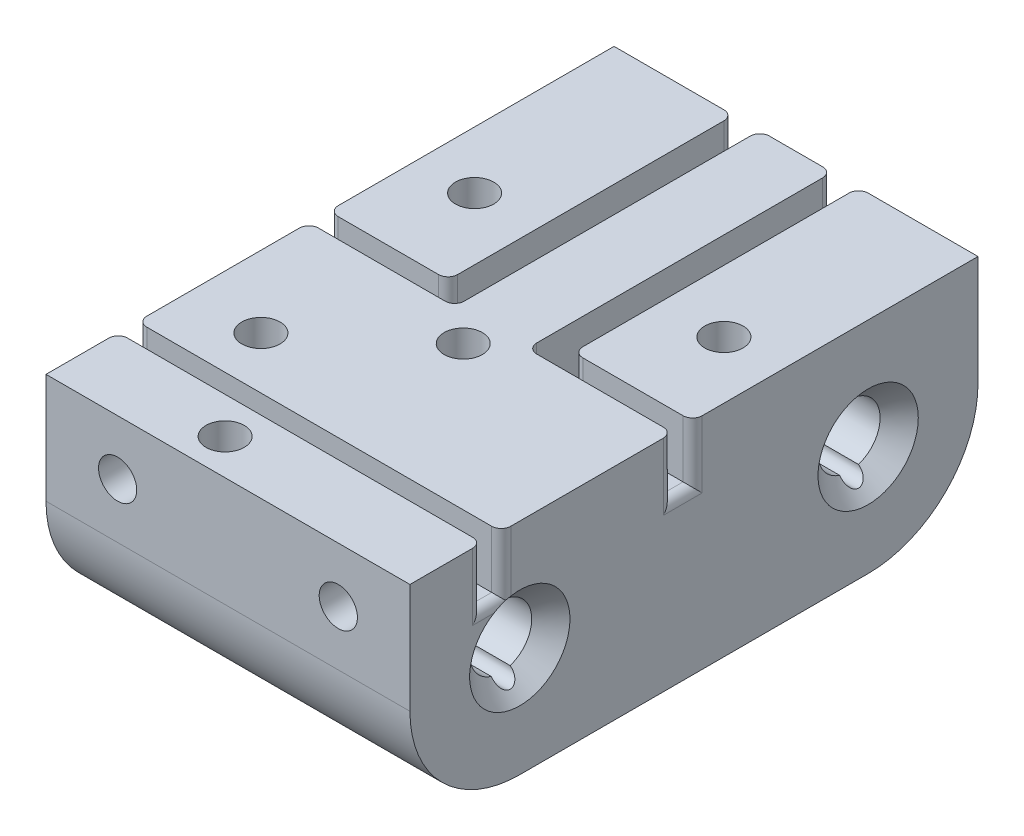
from build123d import *

# Parameters (mm, degrees)
BOSS_EXTRUDE1_DEPTH = 38.1
BOSS_EXTRUDE2_REACH = 55.524
SKETCH2_W           = 38.1
SKETCH2_H           = 36.47
SKETCH3_W           = 38.1
SKETCH3_H           = 2
CUT_EXTRUDE1_DEPTH  = 6
SKETCH4_R           = 1.9999999999999987
SKETCH4_R_2         = 2.0000000000000107
SKETCH4_R_3         = 2.000000000000003
CUT_EXTRUDE2_DEPTH  = 5
CHAMFER1_SIZE       = 2
SKETCH5_R           = 1.0000000000000016
CUT_EXTRUDE3_DEPTH  = 50.679273595736085
SKETCH6_R           = 1.9999999999999996
SKETCH6_R_2         = 2.0000000000000004
CUT_EXTRUDE4_DEPTH  = 5
FILLET1_R           = 1


with BuildPart() as part:
    # Sketch1 → Boss-Extrude1 (new body)
    with BuildSketch(Plane(origin=(0, 0, 0), x_dir=(0, 0, -1), z_dir=(1, 0, 0))):
        with BuildLine():
            ThreePointArc((18.23499999582485, 11.500000000000005), (10.103272014878568, 8.131727982169165), (6.735000000000001, 7.91e-15))
            Line((6.734999999999999, 4.45e-15), (14.985, 5.93e-15))
            ThreePointArc((14.985000000000001, 6.9e-15), (18.235, 3.2500000000000053), (21.485, 6.51e-15))
            Line((21.485000000000003, 8.96e-15), (29.73499999999999, 1.041e-14))
            ThreePointArc((29.735, 6.51e-15), (26.366727982169156, 8.131727985121442), (18.234999995824847, 11.500000000000005))
        make_face()
        with BuildLine():
            Line((14.985, 5.93e-15), (6.734999999999999, 4.45e-15))
            ThreePointArc((6.735000000000001, 7.91e-15), (18.234999999999996, -11.499999999999991), (29.735, 3.69e-15))
            Line((29.73499999999999, 1.041e-14), (21.485000000000003, 8.96e-15))
            ThreePointArc((21.485, 5.71e-15), (18.235, -3.249999999999992), (14.985000000000001, 6.9e-15))
        make_face()
        with BuildLine():
            ThreePointArc((-21.485, 4e-16), (-18.235, 3.2500000000000004), (-14.985, 0))
            Line((-14.985, 5.8e-16), (-6.734999999999999, 2.05e-15))
            ThreePointArc((-6.734999999999999, 0), (-10.103272016354705, 8.131727983645298), (-18.235000000000003, 11.5))
            ThreePointArc((-18.235000000000003, 11.5), (-26.366727983645298, 8.131727983645296), (-29.735, 1.41e-15))
            Line((-29.734999999999996, 0), (-21.485, 1.44e-15))
        make_face()
        with BuildLine():
            Line((-6.734999999999999, 2.05e-15), (-14.985, 5.8e-16))
            ThreePointArc((-14.985, -8e-16), (-18.235, -3.2500000000000004), (-21.485, 4e-16))
            Line((-21.485, 1.44e-15), (-29.734999999999996, 0))
            ThreePointArc((-29.735, 1.41e-15), (-18.235000000000003, -11.5), (-6.734999999999999, -2.82e-15))
        make_face()
        with BuildLine():
            ThreePointArc((-18.235000000000003, 11.5), (-10.103272016354705, 8.131727983645298), (-6.734999999999999, 0))
            Line((-6.734999999999999, 2.05e-15), (6.734999999999999, 4.45e-15))
            ThreePointArc((6.735000000000001, 7.91e-15), (10.103272014878568, 8.131727982169165), (18.23499999582485, 11.500000000000005))
            Line((18.23499999582485, 11.500000000000009), (-18.235000000000003, 11.500000000000002))
        make_face()
        with BuildLine():
            Line((29.734999999999992, 11.50000000000001), (18.23499999582485, 11.500000000000009))
            ThreePointArc((18.234999995824847, 11.500000000000005), (26.366727982169156, 8.131727985121442), (29.735, 6.51e-15))
            Line((29.734999999999992, 1.066e-14), (29.734999999999992, 11.50000000000001))
        make_face()
        with BuildLine():
            Line((-29.735, 11.5), (-29.734999999999996, 0))
            ThreePointArc((-29.735, 1.41e-15), (-26.366727983645298, 8.131727983645296), (-18.235000000000003, 11.5))
            Line((-18.235000000000003, 11.500000000000002), (-29.735, 11.5))
        make_face()
    extrude(amount=BOSS_EXTRUDE1_DEPTH)

    # Sketch2 → Boss-Extrude2 (add, up to next)
    with BuildSketch(Plane(origin=(0, -11.499999999999995, -2.74e-15), x_dir=(-1, 0, 0), z_dir=(0, -1, -2.4e-16)), mode=Mode.PRIVATE) as boss_extrude2_sk1:
        with Locations((-19.05, -1.78e-15)):
            Rectangle(SKETCH2_W, SKETCH2_H)
    boss_extrude2_tool1 = extrude(boss_extrude2_sk1.sketch, amount=-BOSS_EXTRUDE2_REACH, mode=Mode.PRIVATE) - part.part
    add(boss_extrude2_tool1.solids().sort_by_distance((19.05, -11.5, 0))[0])

    # Sketch3 → Cut-Extrude1 (cut)
    with BuildSketch(Plane(origin=(0, 11.500000000000005, 2.01e-15), x_dir=(1, 0, 0), z_dir=(0, 1, 1.8e-16))):
        Polygon((25.600000000007118, 29.734999999999996), (22.840000000007127, 29.734999999999996), (22.84000000000712, -2.210000000000001), (38.10000000000001, -2.2100000000000035), (38.1, -0.13999999999999702), (25.600000000007118, -0.13999999999999777), align=None)
        Polygon((12.499999999992893, -0.13999999999999777), (3.69e-15, -0.13999999999999777), (3.93e-15, -2.2100000000000044), (15.259999999992889, -2.2100000000000017), (15.259999999992884, 29.734999999999996), (12.499999999992893, 29.734999999999996), align=None)
        with Locations((19.05, -21.177500000000002)):
            Rectangle(SKETCH3_W, SKETCH3_H)
    extrude(amount=-CUT_EXTRUDE1_DEPTH, mode=Mode.SUBTRACT)

    # Sketch4 → Cut-Extrude2 (cut)
    with BuildSketch(Plane(origin=(0, 11.500000000000005, 2.01e-15), x_dir=(1, 0, 0), z_dir=(0, 1, 1.8e-16))):
        with Locations(Location((6.000000000000003, 9.13499999999998, 0), (0, 0, 270))):
            Circle(SKETCH4_R)
        with Locations(Location((32.1, 9.134999999999984, 0), (0, 0, 270))):
            Circle(SKETCH4_R_2)
        with BuildLine():
            ThreePointArc((9.500000000000005, -14.734999999999998), (7.5000000000000036, -12.734999999999996), (5.500000000000002, -14.734999999999998))
            Line((5.500000000000002, -14.734999999999998), (9.500000000000005, -14.734999999999998))
        make_face()
        with BuildLine():
            Line((9.500000000000005, -14.734999999999998), (5.500000000000002, -14.734999999999998))
            ThreePointArc((5.500000000000002, -14.734999999999998), (7.5000000000000036, -16.735), (9.500000000000005, -14.734999999999998))
        make_face()
        with BuildLine():
            ThreePointArc((15.000000000000032, -23.98499999999999), (12.999999999999993, -25.985), (15.000000000000034, -27.98500000000001))
            Line((15.000000000000004, -27.98500000000001), (15.000000000000004, -23.98499999999999))
        make_face()
        with BuildLine():
            Line((15.000000000000004, -23.98499999999999), (15.000000000000004, -27.98500000000001))
            ThreePointArc((15.000000000000034, -27.98500000000001), (16.414213562373117, -27.39921356237309), (17.000000000000014, -25.985))
            ThreePointArc((17.000000000000014, -25.985), (16.414213562373117, -24.570786437626907), (15.000000000000032, -23.98499999999999))
        make_face()
        with Locations(Location((19.05, -5.105000000000003, 0), (0, 0, 270))):
            Circle(SKETCH4_R_3)
    extrude(amount=-CUT_EXTRUDE2_DEPTH, mode=Mode.SUBTRACT)

    # Chamfer1
    chamfer1_edges = [part.edges().sort_by_distance(p)[0] for p in [
        (0, -1.93e-15, 21.485),
        (0, 3.13e-15, -14.985),
        (38.1, 9.21e-15, -14.985),
        (38.1, 1.4e-15, 21.485),
    ]]
    chamfer(chamfer1_edges, length=CHAMFER1_SIZE)

    # Sketch5 → Cut-Extrude3 (cut, through all)
    with BuildSketch(Plane.ZY):
        with Locations((-18.235, -3.249999999999993)):
            Circle(SKETCH5_R)
        with Locations((18.235, -3.2499999999999996)):
            Circle(SKETCH5_R)
    extrude(amount=-CUT_EXTRUDE3_DEPTH, mode=Mode.SUBTRACT)

    # Sketch6 → Cut-Extrude4 (cut)
    with BuildSketch(Plane.XY.offset(29.734999999999996)):
        with Locations((7.500000000000001, 5.750000000000005)):
            Circle(SKETCH6_R)
        with Locations((30.599999999999987, 5.750000000000005)):
            Circle(SKETCH6_R_2)
    extrude(amount=-CUT_EXTRUDE4_DEPTH, mode=Mode.SUBTRACT)

    # Fillet1
    # the kernel refuses this fillet: 1 mm, written as the material it adds along each edge
    with BuildSketch(Plane(origin=(15.259999999992889, 11.500000000000005, 2.2100000000000035), x_dir=(-1, 0, 4.4e-16), z_dir=(0, -1, -1.8e-16))) as fillet1_piece_1:
        with BuildLine():
            CenterArc((FILLET1_R, FILLET1_R), FILLET1_R, 180, 90)
            Line((-4.4e-16, FILLET1_R), (-FILLET1_R * 0.02, FILLET1_R))
            Line((-FILLET1_R * 0.02, FILLET1_R), (-FILLET1_R * 0.02, -FILLET1_R * 0.02))
            Line((-FILLET1_R * 0.02, -FILLET1_R * 0.02), (FILLET1_R, -FILLET1_R * 0.02))
            Line((FILLET1_R, -FILLET1_R * 0.02), (FILLET1_R, 0))
        make_face()
    extrude(amount=6)
    with BuildSketch(Plane(origin=(22.84000000000712, 11.500000000000005, 2.2100000000000035), x_dir=(0, 1.8e-16, -1), z_dir=(0, -1, -1.8e-16))) as fillet1_piece_2:
        with BuildLine():
            CenterArc((FILLET1_R, FILLET1_R), FILLET1_R, 180, 90)
            Line((-8.9e-16, FILLET1_R), (-FILLET1_R * 0.02, FILLET1_R))
            Line((-FILLET1_R * 0.02, FILLET1_R), (-FILLET1_R * 0.02, -FILLET1_R * 0.02))
            Line((-FILLET1_R * 0.02, -FILLET1_R * 0.02), (FILLET1_R, -FILLET1_R * 0.02))
            Line((FILLET1_R, -FILLET1_R * 0.02), (FILLET1_R, 0))
        make_face()
    extrude(amount=6)
    # the kernel refuses this fillet: 1 mm, written as the material it takes off along each edge
    with BuildSketch(Plane(origin=(0, 5.500000000000002, 22.177500000000002), x_dir=(0, -1, -1.8e-16), z_dir=(0, 1.8e-16, -1))) as fillet1_2_piece_1:
        with BuildLine():
            CenterArc((FILLET1_R, -FILLET1_R), FILLET1_R, 90, 90)
            Line((1.78e-15, -FILLET1_R), (-FILLET1_R * 0.02, -FILLET1_R))
            Line((-FILLET1_R * 0.02, -FILLET1_R), (-FILLET1_R * 0.02, FILLET1_R * 0.02))
            Line((-FILLET1_R * 0.02, FILLET1_R * 0.02), (FILLET1_R, FILLET1_R * 0.02))
            Line((FILLET1_R, FILLET1_R * 0.02), (FILLET1_R, 0))
        make_face()
    extrude(amount=2, mode=Mode.SUBTRACT)
    with BuildSketch(Plane(origin=(0, 11.500000000000002, 22.177500000000006), x_dir=(0, -1.8e-16, 1), z_dir=(0, -1, -1.8e-16))) as fillet1_2_piece_2:
        with BuildLine():
            CenterArc((FILLET1_R, -FILLET1_R), FILLET1_R, 90, 90)
            Line((-3.55e-15, -FILLET1_R), (-FILLET1_R * 0.02, -FILLET1_R))
            Line((-FILLET1_R * 0.02, -FILLET1_R), (-FILLET1_R * 0.02, FILLET1_R * 0.02))
            Line((-FILLET1_R * 0.02, FILLET1_R * 0.02), (FILLET1_R, FILLET1_R * 0.02))
            Line((FILLET1_R, FILLET1_R * 0.02), (FILLET1_R, 0))
        make_face()
    extrude(amount=6, mode=Mode.SUBTRACT)
    with BuildSketch(Plane(origin=(0, 11.500000000000002, 20.177500000000006), x_dir=(0, 1.8e-16, -1), z_dir=(0, -1, -1.8e-16))) as fillet1_2_piece_3:
        with BuildLine():
            CenterArc((FILLET1_R, FILLET1_R), FILLET1_R, 180, 90)
            Line((3.55e-15, FILLET1_R), (-FILLET1_R * 0.02, FILLET1_R))
            Line((-FILLET1_R * 0.02, FILLET1_R), (-FILLET1_R * 0.02, -FILLET1_R * 0.02))
            Line((-FILLET1_R * 0.02, -FILLET1_R * 0.02), (FILLET1_R, -FILLET1_R * 0.02))
            Line((FILLET1_R, -FILLET1_R * 0.02), (FILLET1_R, 0))
        make_face()
    extrude(amount=6, mode=Mode.SUBTRACT)
    with BuildSketch(Plane(origin=(38.1, 11.500000000000002, 20.177500000000006), x_dir=(-1, 0, 0), z_dir=(0, -1, -1.8e-16))) as fillet1_2_piece_4:
        with BuildLine():
            CenterArc((FILLET1_R, FILLET1_R), FILLET1_R, 180, 90)
            Line((0, FILLET1_R), (-FILLET1_R * 0.02, FILLET1_R))
            Line((-FILLET1_R * 0.02, FILLET1_R), (-FILLET1_R * 0.02, -FILLET1_R * 0.02))
            Line((-FILLET1_R * 0.02, -FILLET1_R * 0.02), (FILLET1_R, -FILLET1_R * 0.02))
            Line((FILLET1_R, -FILLET1_R * 0.02), (FILLET1_R, 0))
        make_face()
    extrude(amount=6, mode=Mode.SUBTRACT)
    with BuildSketch(Plane(origin=(38.1, 11.500000000000002, 22.177500000000006), x_dir=(-1, 0, 0), z_dir=(0, -1, -1.8e-16))) as fillet1_2_piece_5:
        with BuildLine():
            CenterArc((FILLET1_R, -FILLET1_R), FILLET1_R, 90, 89.9999999999998)
            Line((0, -FILLET1_R), (-FILLET1_R * 0.02, -FILLET1_R))
            Line((-FILLET1_R * 0.02, -FILLET1_R), (-FILLET1_R * 0.02, FILLET1_R * 0.02))
            Line((-FILLET1_R * 0.02, FILLET1_R * 0.02), (FILLET1_R, FILLET1_R * 0.02))
            Line((FILLET1_R, FILLET1_R * 0.02), (FILLET1_R, 0))
        make_face()
    extrude(amount=6, mode=Mode.SUBTRACT)
    with BuildSketch(Plane(origin=(38.1, 5.500000000000002, 20.177500000000002), x_dir=(-1, 0, 0), z_dir=(0, -1.8e-16, 1))) as fillet1_2_piece_6:
        with BuildLine():
            CenterArc((FILLET1_R, FILLET1_R), FILLET1_R, 180, 90)
            Line((0, FILLET1_R), (-FILLET1_R * 0.02, FILLET1_R))
            Line((-FILLET1_R * 0.02, FILLET1_R), (-FILLET1_R * 0.02, -FILLET1_R * 0.02))
            Line((-FILLET1_R * 0.02, -FILLET1_R * 0.02), (FILLET1_R, -FILLET1_R * 0.02))
            Line((FILLET1_R, -FILLET1_R * 0.02), (FILLET1_R, 0))
        make_face()
    extrude(amount=2, mode=Mode.SUBTRACT)
    with BuildSketch(Plane(origin=(3.68e-15, 5.500000000000005, 0.139999999999998), x_dir=(-3.68e-15, -1, -1.8e-16), z_dir=(1.2e-16, -1.8e-16, 1))) as fillet1_2_piece_7:
        with BuildLine():
            CenterArc((FILLET1_R, FILLET1_R), FILLET1_R, 180, 90.00000000000023)
            Line((-3.68e-15, FILLET1_R), (-FILLET1_R * 0.02, FILLET1_R))
            Line((-FILLET1_R * 0.02, FILLET1_R), (-FILLET1_R * 0.02, -FILLET1_R * 0.02))
            Line((-FILLET1_R * 0.02, -FILLET1_R * 0.02), (FILLET1_R, -FILLET1_R * 0.02))
            Line((FILLET1_R, -FILLET1_R * 0.02), (FILLET1_R, 0))
        make_face()
    extrude(amount=2.0700000000000074, mode=Mode.SUBTRACT)
    with BuildSketch(Plane(origin=(3.74e-15, 11.500000000000005, 2.210000000000006), x_dir=(-3.74e-15, -1.8e-16, 1), z_dir=(0, -1, -1.8e-16))) as fillet1_2_piece_8:
        with BuildLine():
            CenterArc((FILLET1_R, -FILLET1_R), FILLET1_R, 89.99999999999979, 90.00000000000021)
            Line((-1.97e-15, -FILLET1_R), (-FILLET1_R * 0.02, -FILLET1_R))
            Line((-FILLET1_R * 0.02, -FILLET1_R), (-FILLET1_R * 0.02, FILLET1_R * 0.02))
            Line((-FILLET1_R * 0.02, FILLET1_R * 0.02), (FILLET1_R, FILLET1_R * 0.02))
            Line((FILLET1_R, FILLET1_R * 0.02), (FILLET1_R, 0))
        make_face()
    extrude(amount=6, mode=Mode.SUBTRACT)
    with BuildSketch(Plane(origin=(3.68e-15, 11.500000000000005, 0.13999999999999943), x_dir=(-3.68e-15, 1.8e-16, -1), z_dir=(0, -1, -1.8e-16))) as fillet1_2_piece_9:
        with BuildLine():
            CenterArc((FILLET1_R, FILLET1_R), FILLET1_R, 180, 90.00000000000023)
            Line((-4.82e-15, FILLET1_R), (-FILLET1_R * 0.02, FILLET1_R))
            Line((-FILLET1_R * 0.02, FILLET1_R), (-FILLET1_R * 0.02, -FILLET1_R * 0.02))
            Line((-FILLET1_R * 0.02, -FILLET1_R * 0.02), (FILLET1_R, -FILLET1_R * 0.02))
            Line((FILLET1_R, -FILLET1_R * 0.02), (FILLET1_R, 0))
        make_face()
    extrude(amount=6, mode=Mode.SUBTRACT)
    with BuildSketch(Plane(origin=(12.499999999992893, 11.500000000000005, 0.1399999999999998), x_dir=(-1, 0, 0), z_dir=(0, -1, -1.8e-16))) as fillet1_2_piece_10:
        with BuildLine():
            CenterArc((FILLET1_R, FILLET1_R), FILLET1_R, 180.00000000000003, 90)
            Line((0, FILLET1_R), (-FILLET1_R * 0.02, FILLET1_R))
            Line((-FILLET1_R * 0.02, FILLET1_R), (-FILLET1_R * 0.02, -FILLET1_R * 0.02))
            Line((-FILLET1_R * 0.02, -FILLET1_R * 0.02), (FILLET1_R, -FILLET1_R * 0.02))
            Line((FILLET1_R, -FILLET1_R * 0.02), (FILLET1_R, 0))
        make_face()
    extrude(amount=6, mode=Mode.SUBTRACT)
    with BuildSketch(Plane(origin=(15.259999999992884, 5.500000000000011, -29.734999999999996), x_dir=(0, 0, 1), z_dir=(-1, 0, 0))) as fillet1_2_piece_11:
        with BuildLine():
            CenterArc((FILLET1_R, -FILLET1_R), FILLET1_R, 90, 90)
            Line((3.55e-15, -FILLET1_R), (-FILLET1_R * 0.02, -FILLET1_R))
            Line((-FILLET1_R * 0.02, -FILLET1_R), (-FILLET1_R * 0.02, FILLET1_R * 0.02))
            Line((-FILLET1_R * 0.02, FILLET1_R * 0.02), (FILLET1_R, FILLET1_R * 0.02))
            Line((FILLET1_R, FILLET1_R * 0.02), (FILLET1_R, 0))
        make_face()
    extrude(amount=2.759999999999991, mode=Mode.SUBTRACT)
    with BuildSketch(Plane(origin=(12.499999999992893, 11.50000000000001, -29.734999999999992), x_dir=(-1, 0, 0), z_dir=(0, -1, -1.8e-16))) as fillet1_2_piece_12:
        with BuildLine():
            CenterArc((FILLET1_R, -FILLET1_R), FILLET1_R, 90, 90)
            Line((0, -FILLET1_R), (-FILLET1_R * 0.02, -FILLET1_R))
            Line((-FILLET1_R * 0.02, -FILLET1_R), (-FILLET1_R * 0.02, FILLET1_R * 0.02))
            Line((-FILLET1_R * 0.02, FILLET1_R * 0.02), (FILLET1_R, FILLET1_R * 0.02))
            Line((FILLET1_R, FILLET1_R * 0.02), (FILLET1_R, 0))
        make_face()
    extrude(amount=6, mode=Mode.SUBTRACT)
    with BuildSketch(Plane(origin=(15.259999999992884, 11.50000000000001, -29.734999999999992), x_dir=(1, 0, 0), z_dir=(0, -1, -1.8e-16))) as fillet1_2_piece_13:
        with BuildLine():
            CenterArc((FILLET1_R, FILLET1_R), FILLET1_R, 180, 90)
            Line((1.78e-15, FILLET1_R), (-FILLET1_R * 0.02, FILLET1_R))
            Line((-FILLET1_R * 0.02, FILLET1_R), (-FILLET1_R * 0.02, -FILLET1_R * 0.02))
            Line((-FILLET1_R * 0.02, -FILLET1_R * 0.02), (FILLET1_R, -FILLET1_R * 0.02))
            Line((FILLET1_R, -FILLET1_R * 0.02), (FILLET1_R, 0))
        make_face()
    extrude(amount=6, mode=Mode.SUBTRACT)
    with BuildSketch(Plane(origin=(38.1, 5.500000000000005, 2.2100000000000053), x_dir=(0, -1, -1.8e-16), z_dir=(0, 1.8e-16, -1))) as fillet1_2_piece_14:
        with BuildLine():
            CenterArc((FILLET1_R, FILLET1_R), FILLET1_R, 180, 90)
            Line((0, FILLET1_R), (-FILLET1_R * 0.02, FILLET1_R))
            Line((-FILLET1_R * 0.02, FILLET1_R), (-FILLET1_R * 0.02, -FILLET1_R * 0.02))
            Line((-FILLET1_R * 0.02, -FILLET1_R * 0.02), (FILLET1_R, -FILLET1_R * 0.02))
            Line((FILLET1_R, -FILLET1_R * 0.02), (FILLET1_R, 0))
        make_face()
    extrude(amount=2.0700000000000074, mode=Mode.SUBTRACT)
    with BuildSketch(Plane(origin=(38.10000000000001, 11.500000000000005, 0.13999999999999943), x_dir=(-7.11e-15, 1.8e-16, -1), z_dir=(0, -1, -1.8e-16))) as fillet1_2_piece_15:
        with BuildLine():
            CenterArc((FILLET1_R, -FILLET1_R), FILLET1_R, 90.00000000000041, 89.99999999999959)
            Line((5.97e-15, -FILLET1_R), (-FILLET1_R * 0.02, -FILLET1_R))
            Line((-FILLET1_R * 0.02, -FILLET1_R), (-FILLET1_R * 0.02, FILLET1_R * 0.02))
            Line((-FILLET1_R * 0.02, FILLET1_R * 0.02), (FILLET1_R, FILLET1_R * 0.02))
            Line((FILLET1_R, FILLET1_R * 0.02), (FILLET1_R, 0))
        make_face()
    extrude(amount=6, mode=Mode.SUBTRACT)
    with BuildSketch(Plane(origin=(38.10000000000001, 11.500000000000005, 2.210000000000006), x_dir=(-7.11e-15, -1.8e-16, 1), z_dir=(0, -1, -1.8e-16))) as fillet1_2_piece_16:
        with BuildLine():
            CenterArc((FILLET1_R, FILLET1_R), FILLET1_R, 180, 89.9999999999996)
            Line((7.11e-15, FILLET1_R), (-FILLET1_R * 0.02, FILLET1_R))
            Line((-FILLET1_R * 0.02, FILLET1_R), (-FILLET1_R * 0.02, -FILLET1_R * 0.02))
            Line((-FILLET1_R * 0.02, -FILLET1_R * 0.02), (FILLET1_R, -FILLET1_R * 0.02))
            Line((FILLET1_R, -FILLET1_R * 0.02), (FILLET1_R, 0))
        make_face()
    extrude(amount=6, mode=Mode.SUBTRACT)
    with BuildSketch(Plane(origin=(25.600000000007118, 5.500000000000011, -29.734999999999996), x_dir=(0, -1, 3.55e-15), z_dir=(-1, 0, 0))) as fillet1_2_piece_17:
        with BuildLine():
            CenterArc((FILLET1_R, FILLET1_R), FILLET1_R, 179.9999999999998, 90)
            Line((3.55e-15, FILLET1_R), (-FILLET1_R * 0.02, FILLET1_R))
            Line((-FILLET1_R * 0.02, FILLET1_R), (-FILLET1_R * 0.02, -FILLET1_R * 0.02))
            Line((-FILLET1_R * 0.02, -FILLET1_R * 0.02), (FILLET1_R, -FILLET1_R * 0.02))
            Line((FILLET1_R, -FILLET1_R * 0.02), (FILLET1_R, 0))
        make_face()
    extrude(amount=2.759999999999991, mode=Mode.SUBTRACT)
    with BuildSketch(Plane(origin=(22.840000000007127, 11.50000000000001, -29.734999999999992), x_dir=(-1, 0, 0), z_dir=(0, -1, -1.8e-16))) as fillet1_2_piece_18:
        with BuildLine():
            CenterArc((FILLET1_R, -FILLET1_R), FILLET1_R, 90, 90)
            Line((0, -FILLET1_R), (-FILLET1_R * 0.02, -FILLET1_R))
            Line((-FILLET1_R * 0.02, -FILLET1_R), (-FILLET1_R * 0.02, FILLET1_R * 0.02))
            Line((-FILLET1_R * 0.02, FILLET1_R * 0.02), (FILLET1_R, FILLET1_R * 0.02))
            Line((FILLET1_R, FILLET1_R * 0.02), (FILLET1_R, 0))
        make_face()
    extrude(amount=6, mode=Mode.SUBTRACT)
    with BuildSketch(Plane(origin=(25.600000000007118, 11.50000000000001, -29.734999999999992), x_dir=(1, 0, 0), z_dir=(0, -1, -1.8e-16))) as fillet1_2_piece_19:
        with BuildLine():
            CenterArc((FILLET1_R, FILLET1_R), FILLET1_R, 180, 90)
            Line((0, FILLET1_R), (-FILLET1_R * 0.02, FILLET1_R))
            Line((-FILLET1_R * 0.02, FILLET1_R), (-FILLET1_R * 0.02, -FILLET1_R * 0.02))
            Line((-FILLET1_R * 0.02, -FILLET1_R * 0.02), (FILLET1_R, -FILLET1_R * 0.02))
            Line((FILLET1_R, -FILLET1_R * 0.02), (FILLET1_R, 0))
        make_face()
    extrude(amount=6, mode=Mode.SUBTRACT)
    with BuildSketch(Plane(origin=(25.600000000007118, 11.500000000000005, 0.1399999999999998), x_dir=(0, 1.8e-16, -1), z_dir=(0, -1, -1.8e-16))) as fillet1_2_piece_20:
        with BuildLine():
            CenterArc((FILLET1_R, FILLET1_R), FILLET1_R, 180, 90)
            Line((-1.1e-16, FILLET1_R), (-FILLET1_R * 0.02, FILLET1_R))
            Line((-FILLET1_R * 0.02, FILLET1_R), (-FILLET1_R * 0.02, -FILLET1_R * 0.02))
            Line((-FILLET1_R * 0.02, -FILLET1_R * 0.02), (FILLET1_R, -FILLET1_R * 0.02))
            Line((FILLET1_R, -FILLET1_R * 0.02), (FILLET1_R, 0))
        make_face()
    extrude(amount=6, mode=Mode.SUBTRACT)
    with BuildSketch(Plane(origin=(0, 11.500000000000002, 22.177500000000006), x_dir=(0, -1.8e-16, 1), z_dir=(0, -1, -1.8e-16))) as fillet1_2_piece_21a_section:
        with BuildLine():
            CenterArc((FILLET1_R, -FILLET1_R), FILLET1_R, 90, 90)
            Line((-3.55e-15, -FILLET1_R), (-FILLET1_R * 0.02, -FILLET1_R))
            Line((-FILLET1_R * 0.02, -FILLET1_R), (-FILLET1_R * 0.02, FILLET1_R * 0.02))
            Line((-FILLET1_R * 0.02, FILLET1_R * 0.02), (FILLET1_R, FILLET1_R * 0.02))
            Line((FILLET1_R, FILLET1_R * 0.02), (FILLET1_R, 0))
        make_face()
    fillet1_2_piece_21a = extrude(amount=8.5, mode=Mode.PRIVATE)
    fillet1_2_piece_21a = split(fillet1_2_piece_21a, bisect_by=Plane(origin=(0.22639511426682546, 5.500000000000002, 22.403895114266827), z_dir=(0, -1, -1.8e-16)), keep=Keep.TOP, mode=Mode.PRIVATE)
    with BuildSketch(Plane(origin=(0, 5.500000000000002, 24.677500000000002), x_dir=(0, -1, -1.8e-16), z_dir=(0, 1.8e-16, -1))) as fillet1_2_piece_21b_section:
        with BuildLine():
            CenterArc((FILLET1_R, -FILLET1_R), FILLET1_R, 90, 90)
            Line((0, -FILLET1_R), (-FILLET1_R * 0.02, -FILLET1_R))
            Line((-FILLET1_R * 0.02, -FILLET1_R), (-FILLET1_R * 0.02, FILLET1_R * 0.02))
            Line((-FILLET1_R * 0.02, FILLET1_R * 0.02), (FILLET1_R, FILLET1_R * 0.02))
            Line((FILLET1_R, FILLET1_R * 0.02), (FILLET1_R, 0))
        make_face()
    fillet1_2_piece_21b = extrude(amount=4.5000000000000036, mode=Mode.PRIVATE)
    fillet1_2_piece_21b = split(fillet1_2_piece_21b, bisect_by=Plane(origin=(0.226395114266829, 5.2736048857331745, 22.177500000000006), z_dir=(0, -1.8e-16, 1)), keep=Keep.TOP, mode=Mode.PRIVATE)
    fillet1_2_piece_21 = fillet1_2_piece_21a & fillet1_2_piece_21b
    add(fillet1_2_piece_21, mode=Mode.SUBTRACT)
    with BuildSketch(Plane(origin=(0, 5.500000000000002, 22.177500000000002), x_dir=(0, -1, -1.8e-16), z_dir=(0, 1.8e-16, -1))) as fillet1_2_piece_22a_section:
        with BuildLine():
            CenterArc((FILLET1_R, -FILLET1_R), FILLET1_R, 90, 90)
            Line((1.78e-15, -FILLET1_R), (-FILLET1_R * 0.02, -FILLET1_R))
            Line((-FILLET1_R * 0.02, -FILLET1_R), (-FILLET1_R * 0.02, FILLET1_R * 0.02))
            Line((-FILLET1_R * 0.02, FILLET1_R * 0.02), (FILLET1_R, FILLET1_R * 0.02))
            Line((FILLET1_R, FILLET1_R * 0.02), (FILLET1_R, 0))
        make_face()
    fillet1_2_piece_22a = extrude(amount=4.5000000000000036, mode=Mode.PRIVATE)
    fillet1_2_piece_22a = split(fillet1_2_piece_22a, bisect_by=Plane(origin=(0.2263951142668251, 5.273604885733177, 20.177500000000006), z_dir=(0, 1.8e-16, -1)), keep=Keep.TOP, mode=Mode.PRIVATE)
    with BuildSketch(Plane(origin=(0, 11.500000000000002, 20.177500000000006), x_dir=(0, 1.8e-16, -1), z_dir=(0, -1, -1.8e-16))) as fillet1_2_piece_22b_section:
        with BuildLine():
            CenterArc((FILLET1_R, FILLET1_R), FILLET1_R, 180, 90)
            Line((3.55e-15, FILLET1_R), (-FILLET1_R * 0.02, FILLET1_R))
            Line((-FILLET1_R * 0.02, FILLET1_R), (-FILLET1_R * 0.02, -FILLET1_R * 0.02))
            Line((-FILLET1_R * 0.02, -FILLET1_R * 0.02), (FILLET1_R, -FILLET1_R * 0.02))
            Line((FILLET1_R, -FILLET1_R * 0.02), (FILLET1_R, 0))
        make_face()
    fillet1_2_piece_22b = extrude(amount=8.500000000000009, mode=Mode.PRIVATE)
    fillet1_2_piece_22b = split(fillet1_2_piece_22b, bisect_by=Plane(origin=(0.22639511426682546, 5.500000000000002, 19.951104885733173), z_dir=(0, -1, -1.8e-16)), keep=Keep.TOP, mode=Mode.PRIVATE)
    fillet1_2_piece_22 = fillet1_2_piece_22a & fillet1_2_piece_22b
    add(fillet1_2_piece_22, mode=Mode.SUBTRACT)
    with BuildSketch(Plane(origin=(38.1, 5.500000000000003, 17.677500000000002), x_dir=(-1, 0, 0), z_dir=(0, -1.8e-16, 1))) as fillet1_2_piece_23a_section:
        with BuildLine():
            CenterArc((FILLET1_R, FILLET1_R), FILLET1_R, 179.99999999999994, 90.00000000000006)
            Line((0, FILLET1_R), (-FILLET1_R * 0.02, FILLET1_R))
            Line((-FILLET1_R * 0.02, FILLET1_R), (-FILLET1_R * 0.02, -FILLET1_R * 0.02))
            Line((-FILLET1_R * 0.02, -FILLET1_R * 0.02), (FILLET1_R, -FILLET1_R * 0.02))
            Line((FILLET1_R, -FILLET1_R * 0.02), (FILLET1_R, 0))
        make_face()
    fillet1_2_piece_23a = extrude(amount=4.5, mode=Mode.PRIVATE)
    fillet1_2_piece_23a = split(fillet1_2_piece_23a, bisect_by=Plane(origin=(37.87360488573318, 5.273604885733173, 20.177500000000006), z_dir=(0, 1.8e-16, -1)), keep=Keep.TOP, mode=Mode.PRIVATE)
    with BuildSketch(Plane(origin=(38.1, 11.500000000000002, 20.177500000000006), x_dir=(-1, 0, 0), z_dir=(0, -1, -1.8e-16))) as fillet1_2_piece_23b_section:
        with BuildLine():
            CenterArc((FILLET1_R, FILLET1_R), FILLET1_R, 180, 90)
            Line((0, FILLET1_R), (-FILLET1_R * 0.02, FILLET1_R))
            Line((-FILLET1_R * 0.02, FILLET1_R), (-FILLET1_R * 0.02, -FILLET1_R * 0.02))
            Line((-FILLET1_R * 0.02, -FILLET1_R * 0.02), (FILLET1_R, -FILLET1_R * 0.02))
            Line((FILLET1_R, -FILLET1_R * 0.02), (FILLET1_R, 0))
        make_face()
    fillet1_2_piece_23b = extrude(amount=8.500000000000009, mode=Mode.PRIVATE)
    fillet1_2_piece_23b = split(fillet1_2_piece_23b, bisect_by=Plane(origin=(37.87360488573317, 5.500000000000002, 19.951104885733177), z_dir=(0, -1, -1.8e-16)), keep=Keep.TOP, mode=Mode.PRIVATE)
    fillet1_2_piece_23 = fillet1_2_piece_23a & fillet1_2_piece_23b
    add(fillet1_2_piece_23, mode=Mode.SUBTRACT)
    with BuildSketch(Plane(origin=(38.1, 11.500000000000002, 22.177500000000006), x_dir=(-1, 0, 0), z_dir=(0, -1, -1.8e-16))) as fillet1_2_piece_24a_section:
        with BuildLine():
            CenterArc((FILLET1_R, -FILLET1_R), FILLET1_R, 90, 89.9999999999998)
            Line((0, -FILLET1_R), (-FILLET1_R * 0.02, -FILLET1_R))
            Line((-FILLET1_R * 0.02, -FILLET1_R), (-FILLET1_R * 0.02, FILLET1_R * 0.02))
            Line((-FILLET1_R * 0.02, FILLET1_R * 0.02), (FILLET1_R, FILLET1_R * 0.02))
            Line((FILLET1_R, FILLET1_R * 0.02), (FILLET1_R, 0))
        make_face()
    fillet1_2_piece_24a = extrude(amount=8.5, mode=Mode.PRIVATE)
    fillet1_2_piece_24a = split(fillet1_2_piece_24a, bisect_by=Plane(origin=(37.87360488573318, 5.500000000000002, 22.403895114266835), z_dir=(0, -1, -1.8e-16)), keep=Keep.TOP, mode=Mode.PRIVATE)
    with BuildSketch(Plane(origin=(38.1, 5.500000000000002, 20.177500000000002), x_dir=(-1, 0, 0), z_dir=(0, -1.8e-16, 1))) as fillet1_2_piece_24b_section:
        with BuildLine():
            CenterArc((FILLET1_R, FILLET1_R), FILLET1_R, 180, 90)
            Line((0, FILLET1_R), (-FILLET1_R * 0.02, FILLET1_R))
            Line((-FILLET1_R * 0.02, FILLET1_R), (-FILLET1_R * 0.02, -FILLET1_R * 0.02))
            Line((-FILLET1_R * 0.02, -FILLET1_R * 0.02), (FILLET1_R, -FILLET1_R * 0.02))
            Line((FILLET1_R, -FILLET1_R * 0.02), (FILLET1_R, 0))
        make_face()
    fillet1_2_piece_24b = extrude(amount=4.5, mode=Mode.PRIVATE)
    fillet1_2_piece_24b = split(fillet1_2_piece_24b, bisect_by=Plane(origin=(37.87360488573318, 5.273604885733173, 22.177500000000006), z_dir=(0, -1.8e-16, 1)), keep=Keep.TOP, mode=Mode.PRIVATE)
    fillet1_2_piece_24 = fillet1_2_piece_24a & fillet1_2_piece_24b
    add(fillet1_2_piece_24, mode=Mode.SUBTRACT)
    with BuildSketch(Plane(origin=(0, 5.500000000000005, -2.3600000000000065), x_dir=(0, -1, -1.8e-16), z_dir=(1.2e-16, -1.8e-16, 1))) as fillet1_2_piece_25a_section:
        with BuildLine():
            CenterArc((FILLET1_R, FILLET1_R), FILLET1_R, 180, 90)
            Line((0, FILLET1_R), (-FILLET1_R * 0.02, FILLET1_R))
            Line((-FILLET1_R * 0.02, FILLET1_R), (-FILLET1_R * 0.02, -FILLET1_R * 0.02))
            Line((-FILLET1_R * 0.02, -FILLET1_R * 0.02), (FILLET1_R, -FILLET1_R * 0.02))
            Line((FILLET1_R, -FILLET1_R * 0.02), (FILLET1_R, 0))
        make_face()
    fillet1_2_piece_25a = extrude(amount=4.570000000000012, mode=Mode.PRIVATE)
    fillet1_2_piece_25a = split(fillet1_2_piece_25a, bisect_by=Plane(origin=(0.22639511426682546, 5.273604885733179, 0.1399999999999987), z_dir=(0, 1.8e-16, -1)), keep=Keep.TOP, mode=Mode.PRIVATE)
    with BuildSketch(Plane(origin=(3.68e-15, 11.500000000000005, 0.13999999999999943), x_dir=(-3.68e-15, 1.8e-16, -1), z_dir=(0, -1, -1.8e-16))) as fillet1_2_piece_25b_section:
        with BuildLine():
            CenterArc((FILLET1_R, FILLET1_R), FILLET1_R, 180, 90.00000000000023)
            Line((-4.82e-15, FILLET1_R), (-FILLET1_R * 0.02, FILLET1_R))
            Line((-FILLET1_R * 0.02, FILLET1_R), (-FILLET1_R * 0.02, -FILLET1_R * 0.02))
            Line((-FILLET1_R * 0.02, -FILLET1_R * 0.02), (FILLET1_R, -FILLET1_R * 0.02))
            Line((FILLET1_R, -FILLET1_R * 0.02), (FILLET1_R, 0))
        make_face()
    fillet1_2_piece_25b = extrude(amount=8.500000000000004, mode=Mode.PRIVATE)
    fillet1_2_piece_25b = split(fillet1_2_piece_25b, bisect_by=Plane(origin=(0.22639511426682546, 5.500000000000005, -0.08639511426682489), z_dir=(0, -1, -1.8e-16)), keep=Keep.TOP, mode=Mode.PRIVATE)
    fillet1_2_piece_25 = fillet1_2_piece_25a & fillet1_2_piece_25b
    add(fillet1_2_piece_25, mode=Mode.SUBTRACT)
    with BuildSketch(Plane(origin=(3.74e-15, 11.500000000000005, 2.210000000000006), x_dir=(-3.74e-15, -1.8e-16, 1), z_dir=(0, -1, -1.8e-16))) as fillet1_2_piece_26a_section:
        with BuildLine():
            CenterArc((FILLET1_R, -FILLET1_R), FILLET1_R, 89.99999999999979, 90.00000000000021)
            Line((-1.97e-15, -FILLET1_R), (-FILLET1_R * 0.02, -FILLET1_R))
            Line((-FILLET1_R * 0.02, -FILLET1_R), (-FILLET1_R * 0.02, FILLET1_R * 0.02))
            Line((-FILLET1_R * 0.02, FILLET1_R * 0.02), (FILLET1_R, FILLET1_R * 0.02))
            Line((FILLET1_R, FILLET1_R * 0.02), (FILLET1_R, 0))
        make_face()
    fillet1_2_piece_26a = extrude(amount=8.5, mode=Mode.PRIVATE)
    fillet1_2_piece_26a = split(fillet1_2_piece_26a, bisect_by=Plane(origin=(0.22639511426682546, 5.500000000000005, 2.436395114266828), z_dir=(0, -1, -1.8e-16)), keep=Keep.TOP, mode=Mode.PRIVATE)
    with BuildSketch(Plane(origin=(3.68e-15, 5.500000000000005, 0.139999999999998), x_dir=(-3.68e-15, -1, -1.8e-16), z_dir=(1.2e-16, -1.8e-16, 1))) as fillet1_2_piece_26b_section:
        with BuildLine():
            CenterArc((FILLET1_R, FILLET1_R), FILLET1_R, 180, 90.00000000000023)
            Line((-3.68e-15, FILLET1_R), (-FILLET1_R * 0.02, FILLET1_R))
            Line((-FILLET1_R * 0.02, FILLET1_R), (-FILLET1_R * 0.02, -FILLET1_R * 0.02))
            Line((-FILLET1_R * 0.02, -FILLET1_R * 0.02), (FILLET1_R, -FILLET1_R * 0.02))
            Line((FILLET1_R, -FILLET1_R * 0.02), (FILLET1_R, 0))
        make_face()
    fillet1_2_piece_26b = extrude(amount=4.570000000000012, mode=Mode.PRIVATE)
    fillet1_2_piece_26b = split(fillet1_2_piece_26b, bisect_by=Plane(origin=(0.22639511426682582, 5.273604885733181, 2.2100000000000044), z_dir=(1.2e-16, -1.8e-16, 1)), keep=Keep.TOP, mode=Mode.PRIVATE)
    fillet1_2_piece_26 = fillet1_2_piece_26a & fillet1_2_piece_26b
    add(fillet1_2_piece_26, mode=Mode.SUBTRACT)
    with BuildSketch(Plane(origin=(17.759999999992893, 5.500000000000011, -29.734999999999992), x_dir=(0, 0, 1), z_dir=(-1, 0, 0))) as fillet1_2_piece_27a_section:
        with BuildLine():
            CenterArc((FILLET1_R, -FILLET1_R), FILLET1_R, 90, 90)
            Line((0, -FILLET1_R), (-FILLET1_R * 0.02, -FILLET1_R))
            Line((-FILLET1_R * 0.02, -FILLET1_R), (-FILLET1_R * 0.02, FILLET1_R * 0.02))
            Line((-FILLET1_R * 0.02, FILLET1_R * 0.02), (FILLET1_R, FILLET1_R * 0.02))
            Line((FILLET1_R, FILLET1_R * 0.02), (FILLET1_R, 0))
        make_face()
    fillet1_2_piece_27a = extrude(amount=5.26, mode=Mode.PRIVATE)
    fillet1_2_piece_27a = split(fillet1_2_piece_27a, bisect_by=Plane(origin=(15.259999999992884, 5.273604885733186, -29.508604885733163), z_dir=(1, 0, -1.7e-16)), keep=Keep.TOP, mode=Mode.PRIVATE)
    with BuildSketch(Plane(origin=(15.259999999992884, 11.50000000000001, -29.734999999999992), x_dir=(1, 0, 0), z_dir=(0, -1, -1.8e-16))) as fillet1_2_piece_27b_section:
        with BuildLine():
            CenterArc((FILLET1_R, FILLET1_R), FILLET1_R, 180, 90)
            Line((1.78e-15, FILLET1_R), (-FILLET1_R * 0.02, FILLET1_R))
            Line((-FILLET1_R * 0.02, FILLET1_R), (-FILLET1_R * 0.02, -FILLET1_R * 0.02))
            Line((-FILLET1_R * 0.02, -FILLET1_R * 0.02), (FILLET1_R, -FILLET1_R * 0.02))
            Line((FILLET1_R, -FILLET1_R * 0.02), (FILLET1_R, 0))
        make_face()
    fillet1_2_piece_27b = extrude(amount=8.500000000000004, mode=Mode.PRIVATE)
    fillet1_2_piece_27b = split(fillet1_2_piece_27b, bisect_by=Plane(origin=(15.486395114259713, 5.500000000000011, -29.508604885733163), z_dir=(0, -1, -1.8e-16)), keep=Keep.TOP, mode=Mode.PRIVATE)
    fillet1_2_piece_27 = fillet1_2_piece_27a & fillet1_2_piece_27b
    add(fillet1_2_piece_27, mode=Mode.SUBTRACT)
    with BuildSketch(Plane(origin=(15.259999999992884, 5.500000000000011, -29.734999999999996), x_dir=(0, 0, 1), z_dir=(-1, 0, 0))) as fillet1_2_piece_28a_section:
        with BuildLine():
            CenterArc((FILLET1_R, -FILLET1_R), FILLET1_R, 90, 90)
            Line((3.55e-15, -FILLET1_R), (-FILLET1_R * 0.02, -FILLET1_R))
            Line((-FILLET1_R * 0.02, -FILLET1_R), (-FILLET1_R * 0.02, FILLET1_R * 0.02))
            Line((-FILLET1_R * 0.02, FILLET1_R * 0.02), (FILLET1_R, FILLET1_R * 0.02))
            Line((FILLET1_R, FILLET1_R * 0.02), (FILLET1_R, 0))
        make_face()
    fillet1_2_piece_28a = extrude(amount=5.26, mode=Mode.PRIVATE)
    fillet1_2_piece_28a = split(fillet1_2_piece_28a, bisect_by=Plane(origin=(12.499999999992893, 5.273604885733186, -29.50860488573317), z_dir=(-1, 0, 0)), keep=Keep.TOP, mode=Mode.PRIVATE)
    with BuildSketch(Plane(origin=(12.499999999992893, 11.50000000000001, -29.734999999999992), x_dir=(-1, 0, 0), z_dir=(0, -1, -1.8e-16))) as fillet1_2_piece_28b_section:
        with BuildLine():
            CenterArc((FILLET1_R, -FILLET1_R), FILLET1_R, 90, 90)
            Line((0, -FILLET1_R), (-FILLET1_R * 0.02, -FILLET1_R))
            Line((-FILLET1_R * 0.02, -FILLET1_R), (-FILLET1_R * 0.02, FILLET1_R * 0.02))
            Line((-FILLET1_R * 0.02, FILLET1_R * 0.02), (FILLET1_R, FILLET1_R * 0.02))
            Line((FILLET1_R, FILLET1_R * 0.02), (FILLET1_R, 0))
        make_face()
    fillet1_2_piece_28b = extrude(amount=8.500000000000009, mode=Mode.PRIVATE)
    fillet1_2_piece_28b = split(fillet1_2_piece_28b, bisect_by=Plane(origin=(12.273604885726067, 5.500000000000011, -29.508604885733163), z_dir=(0, -1, -1.8e-16)), keep=Keep.TOP, mode=Mode.PRIVATE)
    fillet1_2_piece_28 = fillet1_2_piece_28a & fillet1_2_piece_28b
    add(fillet1_2_piece_28, mode=Mode.SUBTRACT)
    with BuildSketch(Plane(origin=(38.1, 5.500000000000005, 4.710000000000006), x_dir=(0, -1, -1.8e-16), z_dir=(0, 1.8e-16, -1))) as fillet1_2_piece_29a_section:
        with BuildLine():
            CenterArc((FILLET1_R, FILLET1_R), FILLET1_R, 180, 90)
            Line((0, FILLET1_R), (-FILLET1_R * 0.02, FILLET1_R))
            Line((-FILLET1_R * 0.02, FILLET1_R), (-FILLET1_R * 0.02, -FILLET1_R * 0.02))
            Line((-FILLET1_R * 0.02, -FILLET1_R * 0.02), (FILLET1_R, -FILLET1_R * 0.02))
            Line((FILLET1_R, -FILLET1_R * 0.02), (FILLET1_R, 0))
        make_face()
    fillet1_2_piece_29a = extrude(amount=4.570000000000007, mode=Mode.PRIVATE)
    fillet1_2_piece_29a = split(fillet1_2_piece_29a, bisect_by=Plane(origin=(37.87360488573318, 5.273604885733176, 2.2100000000000044), z_dir=(-1.2e-16, -1.8e-16, 1)), keep=Keep.TOP, mode=Mode.PRIVATE)
    with BuildSketch(Plane(origin=(38.10000000000001, 11.500000000000005, 2.210000000000006), x_dir=(-7.11e-15, -1.8e-16, 1), z_dir=(0, -1, -1.8e-16))) as fillet1_2_piece_29b_section:
        with BuildLine():
            CenterArc((FILLET1_R, FILLET1_R), FILLET1_R, 180, 89.9999999999996)
            Line((7.11e-15, FILLET1_R), (-FILLET1_R * 0.02, FILLET1_R))
            Line((-FILLET1_R * 0.02, FILLET1_R), (-FILLET1_R * 0.02, -FILLET1_R * 0.02))
            Line((-FILLET1_R * 0.02, -FILLET1_R * 0.02), (FILLET1_R, -FILLET1_R * 0.02))
            Line((FILLET1_R, -FILLET1_R * 0.02), (FILLET1_R, 0))
        make_face()
    fillet1_2_piece_29b = extrude(amount=8.5, mode=Mode.PRIVATE)
    fillet1_2_piece_29b = split(fillet1_2_piece_29b, bisect_by=Plane(origin=(37.87360488573318, 5.500000000000005, 2.4363951142668316), z_dir=(0, -1, -1.8e-16)), keep=Keep.TOP, mode=Mode.PRIVATE)
    fillet1_2_piece_29 = fillet1_2_piece_29a & fillet1_2_piece_29b
    add(fillet1_2_piece_29, mode=Mode.SUBTRACT)
    with BuildSketch(Plane(origin=(38.10000000000001, 11.500000000000005, 0.13999999999999943), x_dir=(-7.11e-15, 1.8e-16, -1), z_dir=(0, -1, -1.8e-16))) as fillet1_2_piece_30a_section:
        with BuildLine():
            CenterArc((FILLET1_R, -FILLET1_R), FILLET1_R, 90.00000000000041, 89.99999999999959)
            Line((5.97e-15, -FILLET1_R), (-FILLET1_R * 0.02, -FILLET1_R))
            Line((-FILLET1_R * 0.02, -FILLET1_R), (-FILLET1_R * 0.02, FILLET1_R * 0.02))
            Line((-FILLET1_R * 0.02, FILLET1_R * 0.02), (FILLET1_R, FILLET1_R * 0.02))
            Line((FILLET1_R, FILLET1_R * 0.02), (FILLET1_R, 0))
        make_face()
    fillet1_2_piece_30a = extrude(amount=8.500000000000004, mode=Mode.PRIVATE)
    fillet1_2_piece_30a = split(fillet1_2_piece_30a, bisect_by=Plane(origin=(37.87360488573318, 5.500000000000005, -0.08639511426683022), z_dir=(0, -1, -1.8e-16)), keep=Keep.TOP, mode=Mode.PRIVATE)
    with BuildSketch(Plane(origin=(38.1, 5.500000000000005, 2.2100000000000053), x_dir=(0, -1, -1.8e-16), z_dir=(0, 1.8e-16, -1))) as fillet1_2_piece_30b_section:
        with BuildLine():
            CenterArc((FILLET1_R, FILLET1_R), FILLET1_R, 180, 90)
            Line((0, FILLET1_R), (-FILLET1_R * 0.02, FILLET1_R))
            Line((-FILLET1_R * 0.02, FILLET1_R), (-FILLET1_R * 0.02, -FILLET1_R * 0.02))
            Line((-FILLET1_R * 0.02, -FILLET1_R * 0.02), (FILLET1_R, -FILLET1_R * 0.02))
            Line((FILLET1_R, -FILLET1_R * 0.02), (FILLET1_R, 0))
        make_face()
    fillet1_2_piece_30b = extrude(amount=4.570000000000007, mode=Mode.PRIVATE)
    fillet1_2_piece_30b = split(fillet1_2_piece_30b, bisect_by=Plane(origin=(37.87360488573319, 5.273604885733178, 0.1399999999999987), z_dir=(0, 1.8e-16, -1)), keep=Keep.TOP, mode=Mode.PRIVATE)
    fillet1_2_piece_30 = fillet1_2_piece_30a & fillet1_2_piece_30b
    add(fillet1_2_piece_30, mode=Mode.SUBTRACT)
    with BuildSketch(Plane(origin=(28.100000000007128, 5.500000000000011, -29.734999999999992), x_dir=(0, -1, 0), z_dir=(-1, 0, 0))) as fillet1_2_piece_31a_section:
        with BuildLine():
            CenterArc((FILLET1_R, FILLET1_R), FILLET1_R, 180, 90)
            Line((0, FILLET1_R), (-FILLET1_R * 0.02, FILLET1_R))
            Line((-FILLET1_R * 0.02, FILLET1_R), (-FILLET1_R * 0.02, -FILLET1_R * 0.02))
            Line((-FILLET1_R * 0.02, -FILLET1_R * 0.02), (FILLET1_R, -FILLET1_R * 0.02))
            Line((FILLET1_R, -FILLET1_R * 0.02), (FILLET1_R, 0))
        make_face()
    fillet1_2_piece_31a = extrude(amount=5.260000000000002, mode=Mode.PRIVATE)
    fillet1_2_piece_31a = split(fillet1_2_piece_31a, bisect_by=Plane(origin=(25.600000000007118, 5.273604885733186, -29.50860488573316), z_dir=(1, 0, 0)), keep=Keep.TOP, mode=Mode.PRIVATE)
    with BuildSketch(Plane(origin=(25.600000000007118, 11.50000000000001, -29.734999999999992), x_dir=(1, 0, 0), z_dir=(0, -1, -1.8e-16))) as fillet1_2_piece_31b_section:
        with BuildLine():
            CenterArc((FILLET1_R, FILLET1_R), FILLET1_R, 180, 90)
            Line((0, FILLET1_R), (-FILLET1_R * 0.02, FILLET1_R))
            Line((-FILLET1_R * 0.02, FILLET1_R), (-FILLET1_R * 0.02, -FILLET1_R * 0.02))
            Line((-FILLET1_R * 0.02, -FILLET1_R * 0.02), (FILLET1_R, -FILLET1_R * 0.02))
            Line((FILLET1_R, -FILLET1_R * 0.02), (FILLET1_R, 0))
        make_face()
    fillet1_2_piece_31b = extrude(amount=8.500000000000009, mode=Mode.PRIVATE)
    fillet1_2_piece_31b = split(fillet1_2_piece_31b, bisect_by=Plane(origin=(25.826395114273936, 5.500000000000011, -29.50860488573317), z_dir=(0, -1, -1.8e-16)), keep=Keep.TOP, mode=Mode.PRIVATE)
    fillet1_2_piece_31 = fillet1_2_piece_31a & fillet1_2_piece_31b
    add(fillet1_2_piece_31, mode=Mode.SUBTRACT)
    with BuildSketch(Plane(origin=(22.840000000007127, 11.50000000000001, -29.734999999999992), x_dir=(-1, 0, 0), z_dir=(0, -1, -1.8e-16))) as fillet1_2_piece_32a_section:
        with BuildLine():
            CenterArc((FILLET1_R, -FILLET1_R), FILLET1_R, 90, 90)
            Line((0, -FILLET1_R), (-FILLET1_R * 0.02, -FILLET1_R))
            Line((-FILLET1_R * 0.02, -FILLET1_R), (-FILLET1_R * 0.02, FILLET1_R * 0.02))
            Line((-FILLET1_R * 0.02, FILLET1_R * 0.02), (FILLET1_R, FILLET1_R * 0.02))
            Line((FILLET1_R, FILLET1_R * 0.02), (FILLET1_R, 0))
        make_face()
    fillet1_2_piece_32a = extrude(amount=8.5, mode=Mode.PRIVATE)
    fillet1_2_piece_32a = split(fillet1_2_piece_32a, bisect_by=Plane(origin=(22.613604885740298, 5.500000000000011, -29.508604885733163), z_dir=(0, -1, -1.8e-16)), keep=Keep.TOP, mode=Mode.PRIVATE)
    with BuildSketch(Plane(origin=(25.600000000007118, 5.500000000000011, -29.734999999999996), x_dir=(0, -1, 3.55e-15), z_dir=(-1, 0, 0))) as fillet1_2_piece_32b_section:
        with BuildLine():
            CenterArc((FILLET1_R, FILLET1_R), FILLET1_R, 179.9999999999998, 90)
            Line((3.55e-15, FILLET1_R), (-FILLET1_R * 0.02, FILLET1_R))
            Line((-FILLET1_R * 0.02, FILLET1_R), (-FILLET1_R * 0.02, -FILLET1_R * 0.02))
            Line((-FILLET1_R * 0.02, -FILLET1_R * 0.02), (FILLET1_R, -FILLET1_R * 0.02))
            Line((FILLET1_R, -FILLET1_R * 0.02), (FILLET1_R, 0))
        make_face()
    fillet1_2_piece_32b = extrude(amount=5.260000000000002, mode=Mode.PRIVATE)
    fillet1_2_piece_32b = split(fillet1_2_piece_32b, bisect_by=Plane(origin=(22.840000000007127, 5.273604885733185, -29.508604885733167), z_dir=(-1, 0, -2.2e-16)), keep=Keep.TOP, mode=Mode.PRIVATE)
    fillet1_2_piece_32 = fillet1_2_piece_32a & fillet1_2_piece_32b
    add(fillet1_2_piece_32, mode=Mode.SUBTRACT)


solid = part.part
